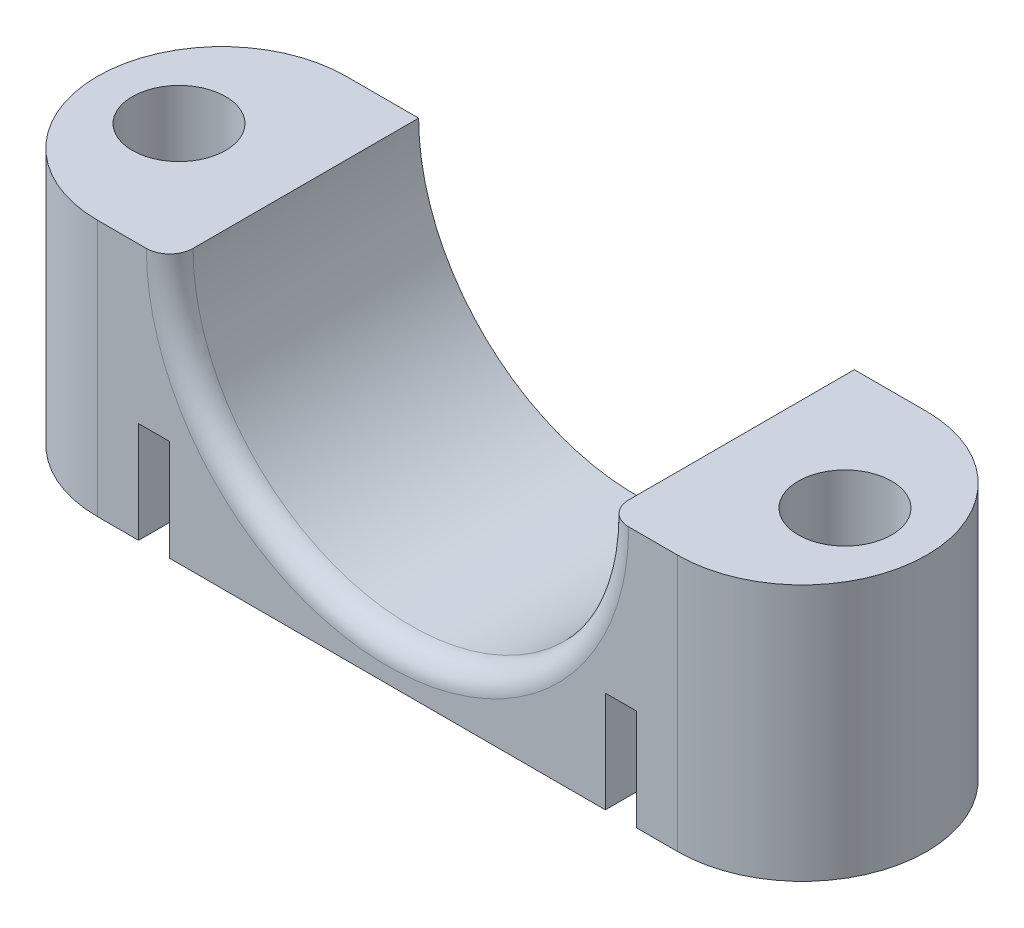
from build123d import *

# Parameters (mm, degrees)
DODANIE_WYCI_GNI_CIE1_DEPTH     = 8
SZKIC4_R                        = 3
WYTNIJ_WYCI_GNI_CIE1_DEPTH      = 51.635955605
ZAOKR_GLENIE1_R                 = 1.5
WYTNIJ_WYCI_GNI_CIE4_START      = -16
WYTNIJ_WYCI_GNI_CIE4_DEPTH      = 16
WYTNIJ_WYCI_GNI_CIE8_DEPTH      = 36.191937997
WYTNIJ_WYCI_GNI_CIE8_DEPTH_BACK = 36.191937997
SZKIC15_W                       = 2
SZKIC15_H                       = 6.5
SZKIC16_R                       = 3
DODANIE_WYCI_GNI_CIE2_DEPTH     = 11.5
DODANIE_WYCI_GNI_CIE3_START     = -3
SZKIC17_R                       = 3
DODANIE_WYCI_GNI_CIE3_DEPTH     = 3
OTWORY_USTALAJ_CE_6_0MM1_D      = 6
OTWORY_USTALAJ_CE_6_0MM1_DEPTH  = 1
OTWORY_USTALAJ_CE_6_0MM1_TIP    = 1.802581857


# Read off the part's stored shape, not the designer's step: Wytnij-wyciągnięcie4
with BuildPart() as part:
    # Szkic1 → Dodanie-wyciągnięcie1 (new, symmetric)
    with BuildSketch(Plane.XY):
        with BuildLine():
            ThreePointArc((-16, 0), (0, -16), (16, 0))
            Line((16, 0), (30, 0))
            Line((30, 0), (30, -40))
            Line((30, -40), (-30, -40))
            Line((-30, -40), (-30, 0))
            Line((-30, 0), (-16, 0))
        make_face()
        with BuildLine():
            ThreePointArc((-14, 0), (0, -14), (14, 0))
            Line((14, 0), (16, 0))
            ThreePointArc((16, 0), (0, -16), (-16, 0))
            Line((-16, 0), (-14, 0))
        make_face()
    extrude(amount=DODANIE_WYCI_GNI_CIE1_DEPTH, both=True)

    # Szkic4 → Wytnij-wyciągnięcie1 (cut, through all)
    with BuildSketch(Plane(origin=(0, 0, 0), x_dir=(1, 0, 0), z_dir=(0, 1, 0))):
        with BuildLine():
            ThreePointArc((-18.65, -8), (-26.65, 0), (-18.65, 8))
            Line((-18.65, 8), (-30, 8))
            Line((-30, 8), (-30, -8))
            Line((-30, -8), (-18.65, -8))
        make_face()
        with BuildLine():
            Line((30, 8), (18.65, 8))
            ThreePointArc((18.65, 8), (26.65, 0), (18.65, -8))
            Line((18.65, -8), (30, -8))
            Line((30, -8), (30, 8))
        make_face()
        with Locations(Location((21.4, 0, 0), (0, 0, 270))):
            Circle(SZKIC4_R)
        with Locations(Location((-21.4, 0, 0), (0, 0, 270))):
            Circle(SZKIC4_R)
    extrude(amount=-WYTNIJ_WYCI_GNI_CIE1_DEPTH, mode=Mode.SUBTRACT)

    # Zaokrąglenie1
    zaokr_glenie1_edges = [part.edges().sort_by_distance(p)[0] for p in [
        (0, -14, 8),
    ]]
    fillet(zaokr_glenie1_edges, radius=ZAOKR_GLENIE1_R)

    # Wytnij-wyciągnięcie4 outline → Wytnij-wyciągnięcie4 (cut)
    with BuildSketch(Plane(origin=(0, 0, -8), x_dir=(-1, 0, 0), z_dir=(0, 0, -1)).offset(WYTNIJ_WYCI_GNI_CIE4_START)):
        Polygon((-16, -16.5), (-16, -5), (-37.876810691, -5), (-37.876810691, -40), (49.702662137, -40), (49.702662137, -5), (16, -5), (16, -16.5), align=None)
    extrude(amount=WYTNIJ_WYCI_GNI_CIE4_DEPTH, mode=Mode.SUBTRACT)

    # Szkic15 → Wytnij-wyciągnięcie8 (cut, two sides: drawn at the far end of the back side and taken through both)
    with BuildSketch(Plane.XY.offset(8).offset(-WYTNIJ_WYCI_GNI_CIE8_DEPTH_BACK)):
        with Locations((15, -13.25)):
            Rectangle(SZKIC15_W, SZKIC15_H)
        with Locations((-15, -13.25)):
            Rectangle(SZKIC15_W, SZKIC15_H)
    extrude(amount=WYTNIJ_WYCI_GNI_CIE8_DEPTH + WYTNIJ_WYCI_GNI_CIE8_DEPTH_BACK, mode=Mode.SUBTRACT)

    # Szkic16 → Dodanie-wyciągnięcie2 (add)
    # profile 1 of 2: a face of its own
    with BuildSketch(Plane.XZ.offset(5)):
        with BuildLine():
            Line((-16, 8), (-16, -8))
            Line((-16, -8), (-18.65, -8))
            ThreePointArc((-18.65, -8), (-26.65, 0), (-18.65, 8))
            Line((-18.65, 8), (-16, 8))
        make_face()
        with Locations(Location((-21.4, 0, 0), (0, 0, 90))):
            Circle(SZKIC16_R, mode=Mode.SUBTRACT)
    # profile 2 of 2: a face of its own
    with BuildSketch(Plane.XZ.offset(5)):
        with BuildLine():
            Line((16, 8), (16, -8))
            Line((16, -8), (18.65, -8))
            ThreePointArc((18.65, -8), (26.65, 0), (18.65, 8))
            Line((18.65, 8), (16, 8))
        make_face()
        with Locations(Location((21.4, 0, 0), (0, 0, 90))):
            Circle(SZKIC16_R, mode=Mode.SUBTRACT)
    extrude(amount=DODANIE_WYCI_GNI_CIE2_DEPTH)

    # Szkic17 → Dodanie-wyciągnięcie3 (add)
    with BuildSketch(Plane.XZ.offset(16.5).offset(DODANIE_WYCI_GNI_CIE3_START)):
        with Locations(Location((-21.4, 0, 0), (0, 0, 90))):
            Circle(SZKIC17_R)
        with Locations(Location((21.4, 0, 0), (0, 0, 90))):
            Circle(SZKIC17_R)
    extrude(amount=DODANIE_WYCI_GNI_CIE3_DEPTH)

    # Otwory ustalające Ø6.0mm1
    with Locations(Plane(origin=(-21.4, -13.5, 0), x_dir=(0, 0, 1), z_dir=(0, 1, 0))):
        with Locations((0, 0), (0, 42.8)):
            Hole(OTWORY_USTALAJ_CE_6_0MM1_D / 2, depth=OTWORY_USTALAJ_CE_6_0MM1_DEPTH)
            with Locations((0, 0, -(OTWORY_USTALAJ_CE_6_0MM1_DEPTH + OTWORY_USTALAJ_CE_6_0MM1_TIP / 2))):  # 118° drill point
                Cone(0, OTWORY_USTALAJ_CE_6_0MM1_D / 2, OTWORY_USTALAJ_CE_6_0MM1_TIP, mode=Mode.SUBTRACT)


solid = part.part
